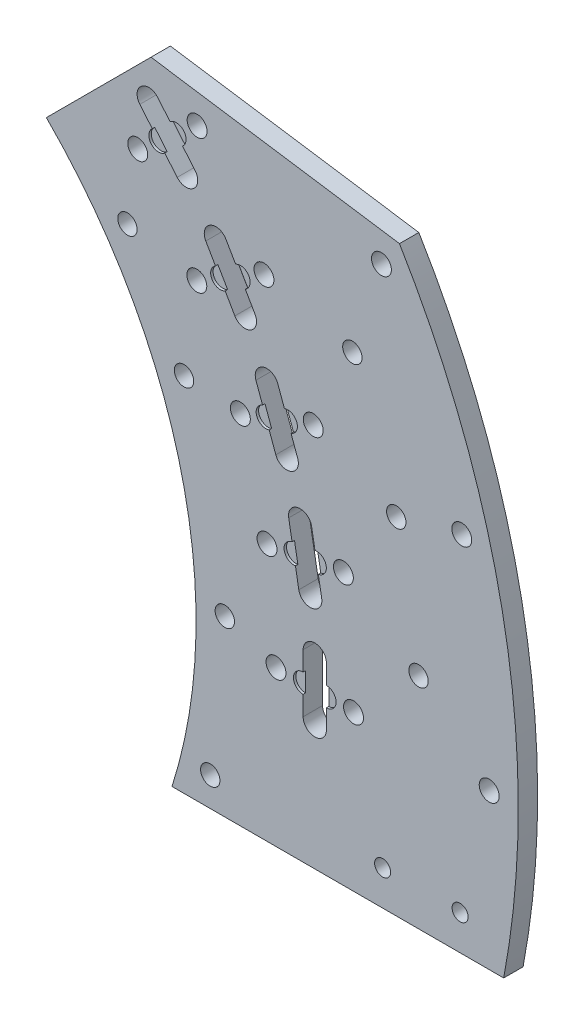
from build123d import *

# Parameters (mm, degrees)
SKETCH1_R           = 3.175
SKETCH1_R_2         = 3.2639
SKETCH1_R_3         = 2.6289
BOSS_EXTRUDE1_DEPTH = 6.35
SKETCH2_R           = 3.175
CUT_EXTRUDE1_DEPTH  = 0.79375


with BuildPart() as part:
    # Sketch1 → Boss-Extrude1 (new body)
    with BuildSketch(Plane.XY):
        with BuildLine():
            ThreePointArc((167.48125, 0), (165.496965553, -25.70454229), (159.591131024, -50.8))
            Line((159.591131024, -50.8), (268.282803213, -50.8))
            ThreePointArc((268.282803213, -50.8), (268.798556268, 47.996235774), (234.123018172, 140.508771477))
            Line((234.123018172, 140.508771477), (152.715190262, 152.715190262))
            Line((152.715190262, 152.715190262), (118.427127597, 118.427127597))
            ThreePointArc((118.427127597, 118.427127597), (154.732498954, 64.092299607), (167.48125, 0))
        make_face()
        with Locations((172.12665951, -41.275)):
            Circle(SKETCH1_R, mode=Mode.SUBTRACT)
        with Locations((193.675, 0)):
            Circle(SKETCH1_R_2, mode=Mode.SUBTRACT)
        with Locations((176.898422575, 6.177429038)):
            Circle(SKETCH1_R, mode=Mode.SUBTRACT)
        with Locations((190.732641565, 33.63131081)):
            Circle(SKETCH1_R_2, mode=Mode.SUBTRACT)
        with Locations((228.6, -39.350556905)):
            Circle(SKETCH1_R_3, mode=Mode.SUBTRACT)
        with BuildLine():
            Line((202.565, -9.525), (202.565, 0))
            Line((202.565, 0), (202.565, 9.525))
            ThreePointArc((202.565, 9.525), (206.375, 13.335), (210.185, 9.525))
            Line((210.185, 9.525), (210.185, 0))
            Line((210.185, 0), (210.185, -9.525))
            ThreePointArc((210.185, -9.525), (206.375, -13.335), (202.565, -9.525))
        make_face(mode=Mode.SUBTRACT)
        with Locations((219.075, 0)):
            Circle(SKETCH1_R_2, mode=Mode.SUBTRACT)
        with Locations((254, -39.350556905)):
            Circle(SKETCH1_R_3, mode=Mode.SUBTRACT)
        with Locations((263.525, 0)):
            Circle(SKETCH1_R_2, mode=Mode.SUBTRACT)
        with BuildLine():
            Line((201.141581381, 25.794749262), (199.487582489, 35.175043109))
            Line((199.487582489, 35.175043109), (197.833583597, 44.555336957))
            ThreePointArc((197.833583597, 44.555336957), (200.924101579, 48.969054052), (205.337818675, 45.87853607))
            Line((205.337818675, 45.87853607), (206.991817567, 36.498242223))
            Line((206.991817567, 36.498242223), (208.645816459, 27.117948375))
            ThreePointArc((208.645816459, 27.117948375), (205.555298477, 22.70423128), (201.141581381, 25.794749262))
        make_face(mode=Mode.SUBTRACT)
        with Locations((215.746758491, 38.041974522)):
            Circle(SKETCH1_R_2, mode=Mode.SUBTRACT)
        with Locations((240.38178065, 21.030680725)):
            Circle(SKETCH1_R, mode=Mode.SUBTRACT)
        with Locations((144.995031539, 101.526614087)):
            Circle(SKETCH1_R, mode=Mode.SUBTRACT)
        with Locations((163.532451502, 67.7373593)):
            Circle(SKETCH1_R, mode=Mode.SUBTRACT)
        with Locations((181.994968331, 66.240751259)):
            Circle(SKETCH1_R_2, mode=Mode.SUBTRACT)
        with BuildLine():
            Line((193.606577595, 60.33073812), (190.348835729, 69.281310333))
            Line((190.348835729, 69.281310333), (187.091093864, 78.231882546))
            ThreePointArc((187.091093864, 78.231882546), (189.368226003, 83.115208177), (194.251551635, 80.838076038))
            Line((194.251551635, 80.838076038), (197.5092935, 71.887503825))
            Line((197.5092935, 71.887503825), (200.767035365, 62.936931612))
            ThreePointArc((200.767035365, 62.936931612), (198.489903226, 58.053605981), (193.606577595, 60.33073812))
        make_face(mode=Mode.SUBTRACT)
        with Locations((167.727470078, 96.8375)):
            Circle(SKETCH1_R_2, mode=Mode.SUBTRACT)
        with Locations((148.363657521, 124.491890306)):
            Circle(SKETCH1_R_2, mode=Mode.SUBTRACT)
        with BuildLine():
            Line((180.188935918, 93.033608029), (175.426435918, 101.2825))
            Line((175.426435918, 101.2825), (170.663935918, 109.531391971))
            ThreePointArc((170.663935918, 109.531391971), (172.058492706, 114.735948759), (177.263049494, 113.341391971))
            Line((177.263049494, 113.341391971), (182.025549494, 105.0925))
            Line((182.025549494, 105.0925), (186.788049494, 96.843608029))
            ThreePointArc((186.788049494, 96.843608029), (185.393492706, 91.639051241), (180.188935918, 93.033608029))
        make_face(mode=Mode.SUBTRACT)
        with Locations((189.724515334, 109.5375)):
            Circle(SKETCH1_R_2, mode=Mode.SUBTRACT)
        with BuildLine():
            Line((161.296344603, 122.909698835), (155.17379262, 130.206272156))
            Line((155.17379262, 130.206272156), (149.051240638, 137.502845477))
            ThreePointArc((149.051240638, 137.502845477), (149.520849174, 142.870495598), (154.888499295, 142.400887063))
            Line((154.888499295, 142.400887063), (161.011051277, 135.104313742))
            Line((161.011051277, 135.104313742), (167.133603259, 127.807740421))
            ThreePointArc((167.133603259, 127.807740421), (166.663994724, 122.4400903), (161.296344603, 122.909698835))
        make_face(mode=Mode.SUBTRACT)
        with Locations((167.821186376, 140.818695592)):
            Circle(SKETCH1_R_2, mode=Mode.SUBTRACT)
        with Locations((205.863160899, 74.928062899)):
            Circle(SKETCH1_R_2, mode=Mode.SUBTRACT)
        with Locations((233.077901884, 62.453035583)):
            Circle(SKETCH1_R, mode=Mode.SUBTRACT)
        with Locations((254.545603373, 68.205288861)):
            Circle(SKETCH1_R_2, mode=Mode.SUBTRACT)
        with Locations((218.692069012, 101.977786558)):
            Circle(SKETCH1_R, mode=Mode.SUBTRACT)
        with Locations((228.219344532, 131.7625)):
            Circle(SKETCH1_R_2, mode=Mode.SUBTRACT)
    extrude(amount=BOSS_EXTRUDE1_DEPTH)

    # Sketch2 → Cut-Extrude1 (cut)
    with BuildSketch(Plane.XY.offset(6.35)):
        with Locations((202.565, 0)):
            Circle(SKETCH2_R)
        with Locations((210.185, 0)):
            Circle(SKETCH2_R)
        with Locations((199.487582489, 35.175043109)):
            Circle(SKETCH2_R)
        with Locations((206.991817567, 36.498242223)):
            Circle(SKETCH2_R)
        with Locations((190.348835729, 69.281310333)):
            Circle(SKETCH2_R)
        with Locations((197.5092935, 71.887503825)):
            Circle(SKETCH2_R)
        with Locations((175.426435918, 101.2825)):
            Circle(SKETCH2_R)
        with Locations((182.025549494, 105.0925)):
            Circle(SKETCH2_R)
        with Locations((155.17379262, 130.206272156)):
            Circle(SKETCH2_R)
        with Locations((161.011051277, 135.104313742)):
            Circle(SKETCH2_R)
    extrude(amount=-CUT_EXTRUDE1_DEPTH, mode=Mode.SUBTRACT)


solid = part.part
